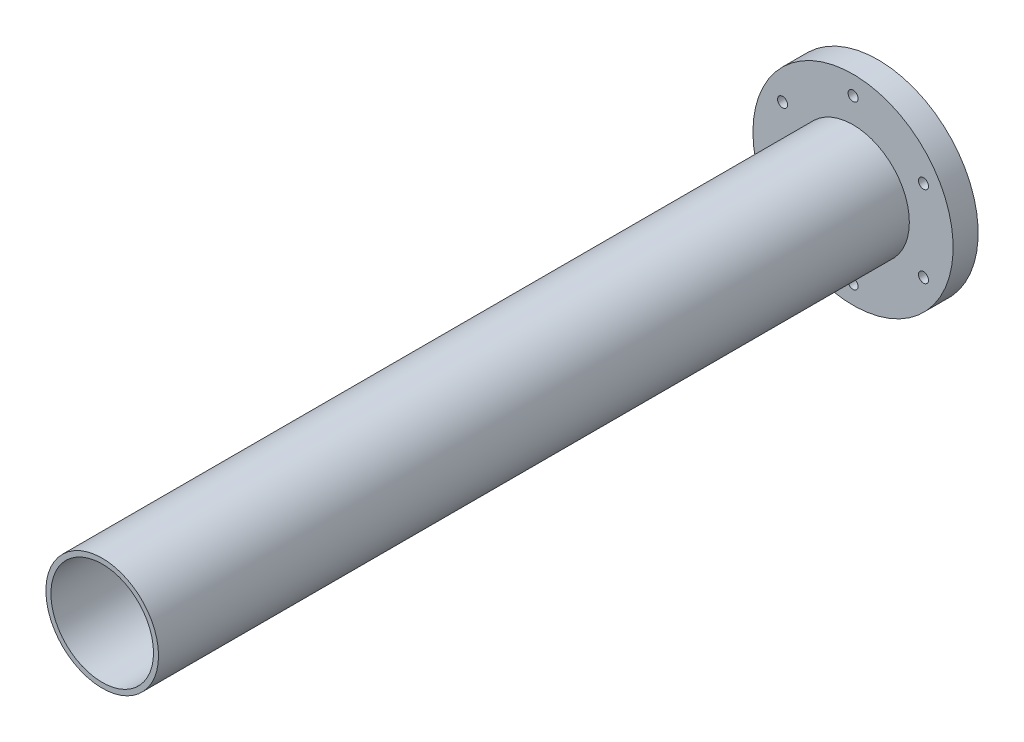
from build123d import *

# Parameters (mm, degrees)
SKETCH1_R           = 22.5
SKETCH1_R_2         = 20.5
BOSS_EXTRUDE1_DEPTH = 300
SKETCH2_R           = 40
SKETCH2_R_2         = 2
BOSS_EXTRUDE2_DEPTH = 10


with BuildPart() as part:
    # Sketch1 → Boss-Extrude1 (new body)
    with BuildSketch(Plane.XY):
        Circle(SKETCH1_R)
        Circle(SKETCH1_R_2, mode=Mode.SUBTRACT)
    extrude(amount=BOSS_EXTRUDE1_DEPTH)

    # Sketch2 → Boss-Extrude2 (add)
    with BuildSketch(Plane(origin=(0, 0, 0), x_dir=(-1, 0, 0), z_dir=(0, 0, -1))):
        Circle(SKETCH2_R)
        with Locations((0, 32.5)):
            Circle(SKETCH2_R_2, mode=Mode.SUBTRACT)
        with Locations((28.145825623, 16.25)):
            Circle(SKETCH2_R_2, mode=Mode.SUBTRACT)
        with Locations((28.145825623, -16.25)):
            Circle(SKETCH2_R_2, mode=Mode.SUBTRACT)
        with Locations((0, -32.5)):
            Circle(SKETCH2_R_2, mode=Mode.SUBTRACT)
        with Locations((-28.145825623, -16.25)):
            Circle(SKETCH2_R_2, mode=Mode.SUBTRACT)
        with Locations((-28.145825623, 16.25)):
            Circle(SKETCH2_R_2, mode=Mode.SUBTRACT)
    extrude(amount=BOSS_EXTRUDE2_DEPTH)


solid = part.part
